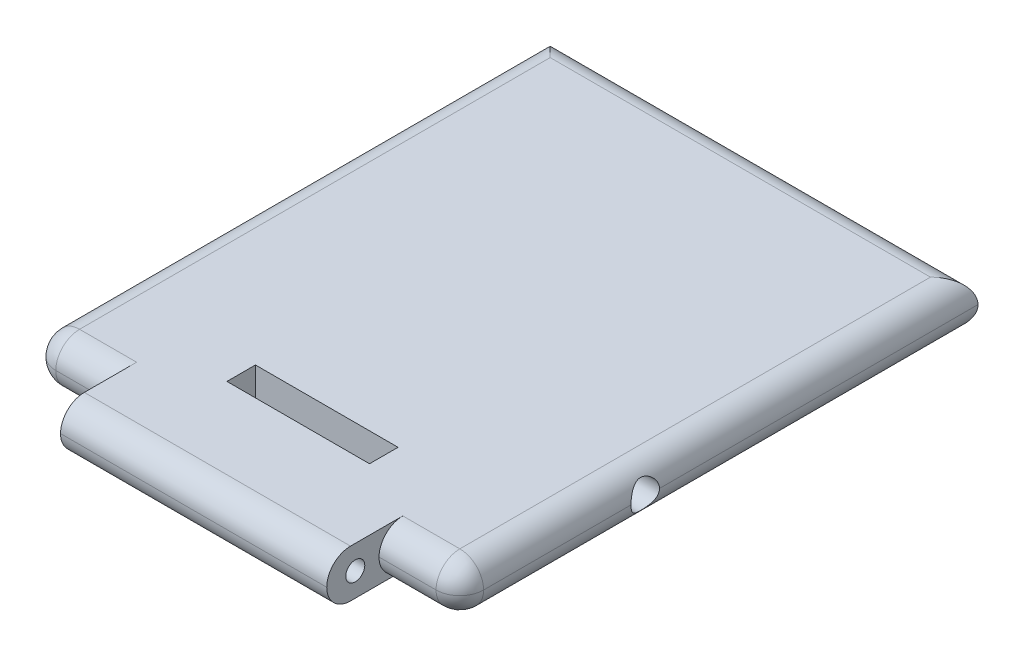
from build123d import *

# Parameters (mm, degrees)
SKETCH1_W               = 45
SKETCH1_H               = 60
BOSS_EXTRUDE1_DEPTH     = 2.5
CUT_EXTRUDE1_DEPTH      = 38.831864876
CUT_EXTRUDE1_DEPTH_BACK = 38.831864876
SKETCH2_W               = 8.5
SKETCH2_H               = 5.5
CUT_EXTRUDE2_DEPTH      = 48.312788969
CUT_EXTRUDE2_DEPTH_BACK = 48.312788969
SKETCH9_R               = 1
FILLET1_R               = 2.5
CUT_EXTRUDE3_DEPTH      = 38.831864876
CUT_EXTRUDE3_DEPTH_BACK = 38.831864876
SKETCH13_W              = 15
SKETCH13_H              = 3
CUT_EXTRUDE4_START      = -6
SKETCH11_R              = 1.5
CUT_EXTRUDE4_DEPTH      = 59.08166664


with BuildPart() as part:
    # Sketch1 → Boss-Extrude1 (new, symmetric)
    with BuildSketch(Plane(origin=(0, 0, 0), x_dir=(1, 0, 0), z_dir=(0, 1, 0))):
        Rectangle(SKETCH1_W, SKETCH1_H)
    extrude(amount=BOSS_EXTRUDE1_DEPTH, both=True)

    # Sketch2 → Cut-Extrude1 (cut, two sides: drawn at the far end of the back side and taken through both)
    with BuildSketch(Plane(origin=(0, 2.5, 0), x_dir=(1, 0, 0), z_dir=(0, 1, 0)).offset(-CUT_EXTRUDE1_DEPTH_BACK)):
        with Locations((-18.25, -27.25)):
            Rectangle(SKETCH2_W, SKETCH2_H)
        with Locations((18.25, -27.25)):
            Rectangle(SKETCH2_W, SKETCH2_H)
    extrude(amount=CUT_EXTRUDE1_DEPTH + CUT_EXTRUDE1_DEPTH_BACK, mode=Mode.SUBTRACT)

    # Sketch9 → Cut-Extrude2 (cut, two sides: drawn at the far end of the back side and taken through both)
    with BuildSketch(Plane.ZY.offset(14).offset(-CUT_EXTRUDE2_DEPTH_BACK)):
        with Locations(Location((27, 0, 0), (0, 0, 180))):
            Circle(SKETCH9_R)
    extrude(amount=CUT_EXTRUDE2_DEPTH + CUT_EXTRUDE2_DEPTH_BACK, mode=Mode.SUBTRACT)

    # Fillet1
    fillet1_edges = [part.edges().sort_by_distance(p)[0] for p in [
        (-22.5, 2.5, -2.75),
        (22.5, -2.5, -2.75),
        (0, -2.5, 30),
        (22.5, 2.5, -2.75),
        (0, 2.5, 30),
        (-18.25, 2.5, 24.5),
        (-18.25, -2.5, 24.5),
        (-22.5, 0, 24.5),
        (18.25, 2.5, 24.5),
        (22.5, 0, 24.5),
        (18.25, -2.5, 24.5),
        (-22.5, -2.5, -2.75),
        (0, -2.5, -30),
        (0, 2.5, -30),
    ]]
    fillet(fillet1_edges, radius=FILLET1_R - 0.0001)  # a hair under: the kernel refuses the full size

    # Sketch13 → Cut-Extrude3 (cut, two sides: drawn at the far end of the back side and taken through both)
    with BuildSketch(Plane.XZ.offset(2.5).offset(-CUT_EXTRUDE3_DEPTH_BACK)):
        with Locations((0, 17.5)):
            Rectangle(SKETCH13_W, SKETCH13_H)
    extrude(amount=CUT_EXTRUDE3_DEPTH + CUT_EXTRUDE3_DEPTH_BACK, mode=Mode.SUBTRACT)

    # Sketch11 → Cut-Extrude4 (cut)
    with BuildSketch(Plane(origin=(20, 0, 0), x_dir=(0, 0, -1), z_dir=(1, 0, 0)).offset(CUT_EXTRUDE4_START)):
        with Locations((-5, 0)):
            Circle(SKETCH11_R)
    cut_extrude4 = extrude(amount=CUT_EXTRUDE4_DEPTH, mode=Mode.SUBTRACT)

    # Mirror1: Cut-Extrude4 across plane
    add(cut_extrude4.mirror(Plane(origin=(0, 0, 0), x_dir=(0, 0, 1), z_dir=(1, 0, 0))), mode=Mode.SUBTRACT)


solid = part.part
